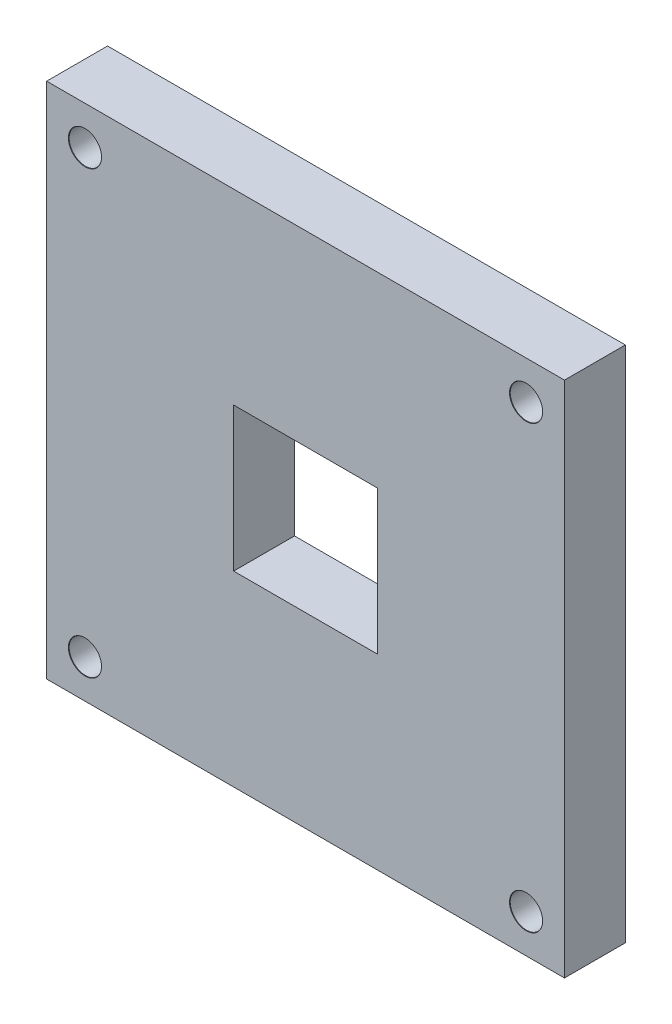
from build123d import *

# Parameters (mm, degrees)
SKETCH1_W           = 54
SKETCH1_H           = 54
BOSS_EXTRUDE1_DEPTH = 6.35
SKETCH6_W           = 15
SKETCH6_H           = 15
CUT_EXTRUDE1_DEPTH  = 10


# Read off the part's stored shape, not the designer's step: M3 Clearance Hole1
with BuildPart() as part:
    # Sketch1 → Boss-Extrude1 (new body)
    with BuildSketch(Plane.XY):
        Rectangle(SKETCH1_W, SKETCH1_H)
    extrude(amount=-BOSS_EXTRUDE1_DEPTH)

    # M3 Clearance Hole1 outline → M3 Clearance Hole1 (revolve, cut)
    with BuildSketch(Plane(origin=(23, -23, 0), x_dir=(1, 0, 0), z_dir=(0, -1, 0))):
        Polygon((0, -6.35), (1.7, -6.35), (1.7, -0.04330127), (1.725, 0), (0, 0), align=None)
    revolve(axis=Axis((23, -23, 0), (0, 0, 1)), mode=Mode.SUBTRACT)

    # M3 Clearance Hole1 2 outline → M3 Clearance Hole1 2 (revolve, cut)
    with BuildSketch(Plane(origin=(-23, 23, 0), x_dir=(1, 0, 0), z_dir=(0, -1, 0))):
        Polygon((0, -6.35), (1.7, -6.35), (1.7, -0.04330127), (1.725, 0), (0, 0), align=None)
    revolve(axis=Axis((-23, 23, 0), (0, 0, 1)), mode=Mode.SUBTRACT)

    # M3 Clearance Hole1 3 outline → M3 Clearance Hole1 3 (revolve, cut)
    with BuildSketch(Plane(origin=(-23, -23, 0), x_dir=(1, 0, 0), z_dir=(0, -1, 0))):
        Polygon((0, -6.35), (1.7, -6.35), (1.7, -0.04330127), (1.725, 0), (0, 0), align=None)
    revolve(axis=Axis((-23, -23, 0), (0, 0, 1)), mode=Mode.SUBTRACT)

    # M3 Clearance Hole1 4 outline → M3 Clearance Hole1 4 (revolve, cut)
    with BuildSketch(Plane(origin=(23, 23, 0), x_dir=(1, 0, 0), z_dir=(0, -1, 0))):
        Polygon((0, -6.35), (1.7, -6.35), (1.7, -0.04330127), (1.725, 0), (0, 0), align=None)
    revolve(axis=Axis((23, 23, 0), (0, 0, 1)), mode=Mode.SUBTRACT)

    # Sketch6 → Cut-Extrude1 (cut)
    with BuildSketch(Plane.XY):
        Rectangle(SKETCH6_W, SKETCH6_H)
    extrude(amount=-CUT_EXTRUDE1_DEPTH, mode=Mode.SUBTRACT)


solid = part.part
